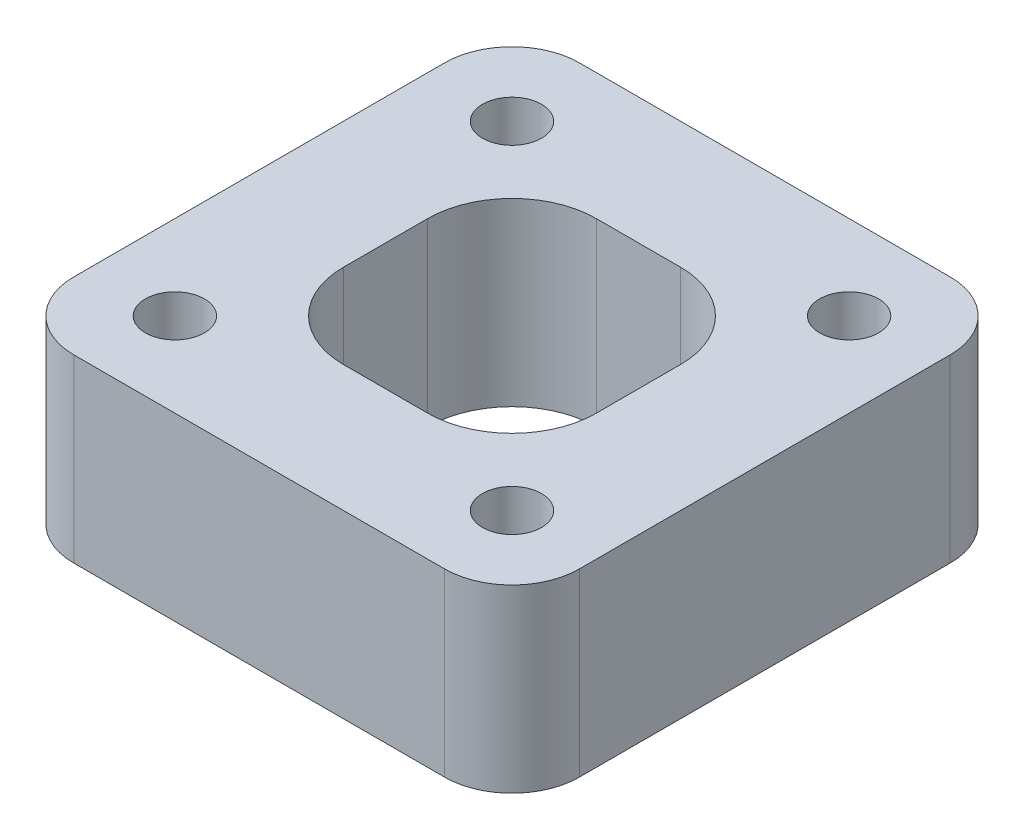
from build123d import *

# Parameters (mm, degrees)
SKETCH_1_W             = 30
SKETCH_1_H             = 30
EXTRUDE_397_DEPTH      = 5.35
SKETCH_2_R             = 1.75
CUT_EXTRUDE_617_DEPTH  = 24.758998295
SKETCH_4_W             = 15
SKETCH_4_H             = 15
CUT_EXTRUDE_1117_DEPTH = 24.758998295
FILLET_3_R             = 5
FILLET_6_R             = 4


with BuildPart() as part:
    # Эскиз1 → Extrude 397 (new, symmetric)
    with BuildSketch(Plane(origin=(0, 0, 0), x_dir=(1, 0, 0), z_dir=(0, 1, 0))):
        Rectangle(SKETCH_1_W, SKETCH_1_H)
    extrude(amount=EXTRUDE_397_DEPTH, both=True)

    # Эскиз2 → Cut-Extrude 617 (cut, through all)
    with BuildSketch(Plane(origin=(0, -5.35, 0), x_dir=(1, 0, 0), z_dir=(0, 1, 0))):
        with Locations((-10, 10)):
            Circle(SKETCH_2_R)
        with Locations((10, 10)):
            Circle(SKETCH_2_R)
        with Locations((10, -10)):
            Circle(SKETCH_2_R)
        with Locations((-10, -10)):
            Circle(SKETCH_2_R)
    extrude(amount=CUT_EXTRUDE_617_DEPTH, mode=Mode.SUBTRACT)

    # Эскиз4 → Cut-Extrude 1117 (cut, through all)
    with BuildSketch(Plane(origin=(0, 5.35, 0), x_dir=(1, 0, 0), z_dir=(0, 1, 0))):
        Rectangle(SKETCH_4_W, SKETCH_4_H)
    extrude(amount=-CUT_EXTRUDE_1117_DEPTH, mode=Mode.SUBTRACT)

    # Скругление3
    fillet_3_edges = [part.edges().sort_by_distance(p)[0] for p in [
        (-7.5, 0, 7.5),
        (7.5, 0, 7.5),
        (7.5, 0, -7.5),
        (-7.5, 0, -7.5),
    ]]
    fillet(fillet_3_edges, radius=FILLET_3_R)

    # Скругление6
    fillet_6_edges = [part.edges().sort_by_distance(p)[0] for p in [
        (-15, 0, 15),
        (-15, 0, -15),
        (15, 0, -15),
        (15, 0, 15),
    ]]
    fillet(fillet_6_edges, radius=FILLET_6_R)


solid = part.part
